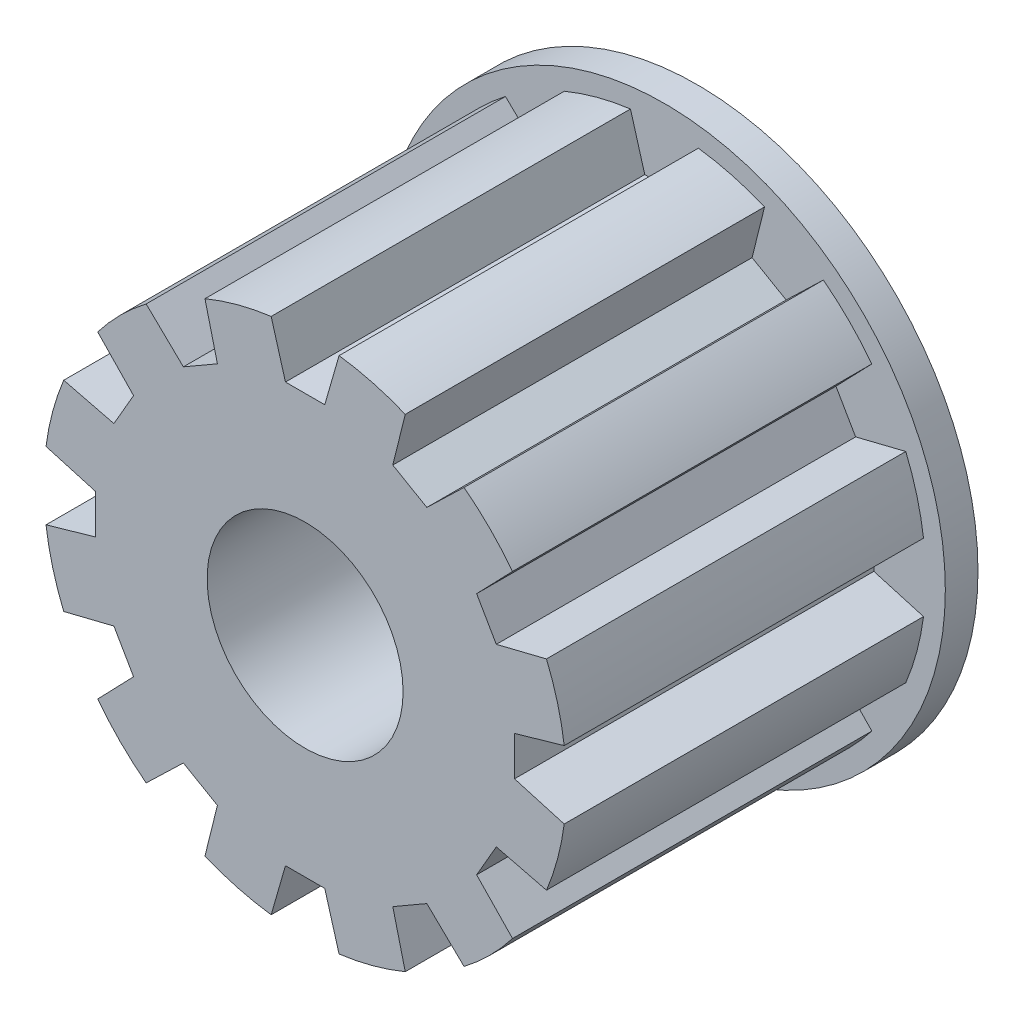
from build123d import *

# Parameters (mm, degrees)
SKETCH1_R           = 4
SKETCH1_R_2         = 1.5
BOSS_EXTRUDE1_DEPTH = 6
CUT_EXTRUDE2_DEPTH  = 6.2
CIRPATTERN1_COUNT   = 12
SKETCH3_R           = 4.3
SKETCH3_R_2         = 1.5
BOSS_EXTRUDE2_DEPTH = 0.5


with BuildPart() as part:
    # Sketch1 → Boss-Extrude1 (new body)
    with BuildSketch(Plane.XY):
        Circle(SKETCH1_R)
        Circle(SKETCH1_R_2, mode=Mode.SUBTRACT)
    extrude(amount=BOSS_EXTRUDE1_DEPTH)

    # Sketch2 → Cut-Extrude2 (cut)
    with BuildSketch(Plane.XY):
        Polygon((3.205627037, -0.300904277), (4.354466102, -0.631367537), (4.354466102, 0.631367537), (3.205627037, 0.300904277), align=None)
    cut_extrude2 = extrude(amount=CUT_EXTRUDE2_DEPTH, mode=Mode.SUBTRACT)

    # CirPattern1: Cut-Extrude2 ×12 about axis
    cirpattern1_axis = Axis((0, 0, -0.3), (0, 0, 1))
    for i in range(1, CIRPATTERN1_COUNT):
        add(cut_extrude2.rotate(cirpattern1_axis, i * 360 / CIRPATTERN1_COUNT), mode=Mode.SUBTRACT)

    # Sketch3 → Boss-Extrude2 (add)
    with BuildSketch(Plane.XY):
        Circle(SKETCH3_R)
        Circle(SKETCH3_R_2, mode=Mode.SUBTRACT)
    extrude(amount=BOSS_EXTRUDE2_DEPTH)


solid = part.part
